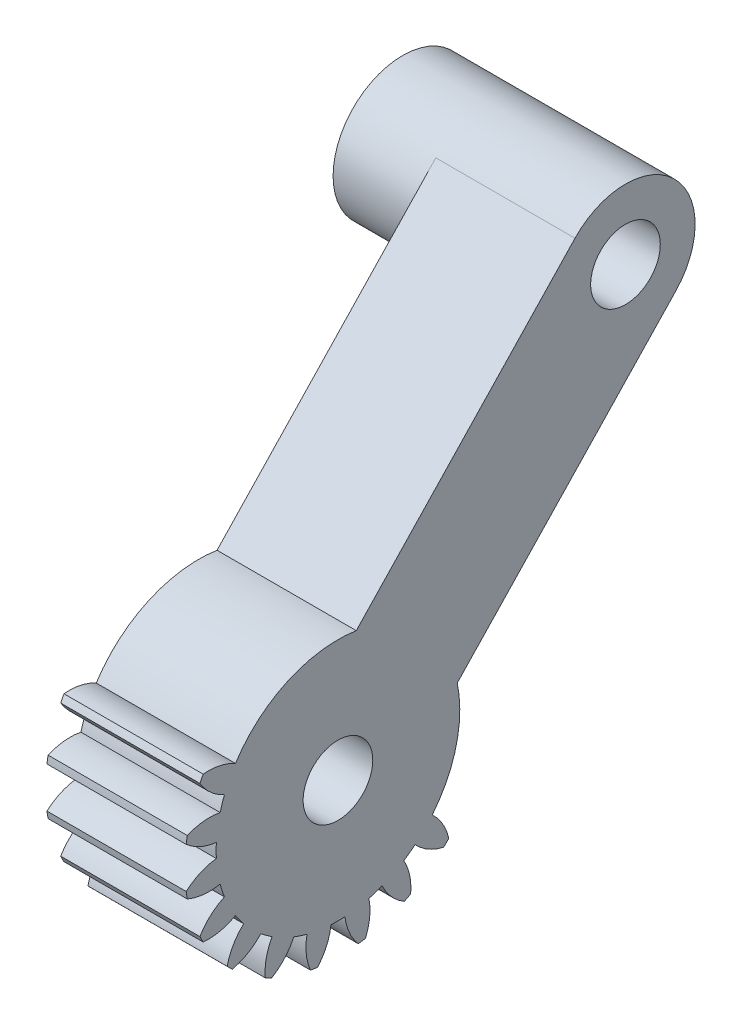
from build123d import *
from build123d.topology import SkipClean

# Parameters (mm, degrees)
SKETCH1_R           = 2.5
BOSS_EXTRUDE1_DEPTH = 10
SKETCH2_R           = 2.5
BOSS_EXTRUDE2_DEPTH = 10
SKETCH3_R           = 5
SKETCH3_R_2         = 2.5
BOSS_EXTRUDE3_DEPTH = 6
SKETCH4_R           = 2.5
CUT_EXTRUDE1_DEPTH  = 41.209967862
CUT_EXTRUDE2_DEPTH  = 41.209967862


with BuildPart() as part:
    # Sketch1 → Boss-Extrude1 (new body)
    with BuildSketch(Plane(origin=(4.043870029, 0, 0), x_dir=(0, 0, -1), z_dir=(1, 0, 0))):
        with BuildLine():
            ThreePointArc((-10.029541992, 0.342879069), (-9.019080639, -0.304016541), (-7.862233613, -0.622153359))
            ThreePointArc((-7.862233613, -0.622153359), (-7.876528296, -1.122077366), (-7.862233613, -1.622001374))
            ThreePointArc((-7.862233613, -1.622001374), (-9.019080639, -1.940138191), (-10.029541992, -2.587033801))
            ThreePointArc((-10.029541992, -2.587033801), (-9.992100042, -2.842856482), (-9.948655897, -3.097728508))
            ThreePointArc((-9.948655897, -3.097728508), (-8.787748306, -3.400713063), (-7.58921172, -3.345793765))
            ThreePointArc((-7.58921172, -3.345793765), (-7.448321757, -3.82566705), (-7.280241692, -4.296705735))
            ThreePointArc((-7.280241692, -4.296705735), (-8.282158911, -4.956757219), (-9.043263028, -5.884241235))
            ThreePointArc((-9.043263028, -5.884241235), (-8.928600062, -6.115972863), (-8.808522437, -6.344945585))
            ThreePointArc((-8.808522437, -6.344945585), (-7.610806331, -6.274360846), (-6.487901298, -5.851761317))
            ThreePointArc((-6.487901298, -5.851761317), (-6.20561798, -6.264610538), (-5.90020538, -6.660655353))
            ThreePointArc((-5.90020538, -6.660655353), (-6.649118154, -7.598011066), (-7.086362862, -8.715294889))
            ThreePointArc((-7.086362862, -8.715294889), (-6.905702889, -8.900251959), (-6.720745819, -9.080911932))
            ThreePointArc((-6.720745819, -9.080911932), (-5.603461996, -8.643667224), (-4.666106283, -7.89475445))
            ThreePointArc((-4.666106283, -7.89475445), (-4.270061468, -8.20016705), (-3.857212247, -8.482450368))
            ThreePointArc((-3.857212247, -8.482450368), (-4.279811776, -9.605355401), (-4.350396515, -10.803071507))
            ThreePointArc((-4.350396515, -10.803071507), (-4.121423793, -10.923149132), (-3.889692165, -11.037812099))
            ThreePointArc((-3.889692165, -11.037812099), (-2.962208149, -10.276707981), (-2.302156665, -9.274790762))
            ThreePointArc((-2.302156665, -9.274790762), (-1.83111798, -9.442870827), (-1.351244695, -9.583760791))
            ThreePointArc((-1.351244695, -9.583760791), (-1.406163992, -10.782297376), (-1.103179437, -11.943204968))
            ThreePointArc((-1.103179437, -11.943204968), (-0.848307411, -11.986649113), (-0.592484731, -12.024091063))
            ThreePointArc((-0.592484731, -12.024091063), (0.054410879, -11.01362971), (0.372547697, -9.856782684))
            ThreePointArc((0.372547697, -9.856782684), (0.872471704, -9.871077366), (1.372395712, -9.856782684))
            ThreePointArc((1.372395712, -9.856782684), (1.690532529, -11.01362971), (2.337428139, -12.024091063))
            ThreePointArc((2.337428139, -12.024091063), (2.59325082, -11.986649113), (2.848122846, -11.943204968))
            ThreePointArc((2.848122846, -11.943204968), (3.151107401, -10.782297376), (3.096188103, -9.583760791))
            ThreePointArc((3.096188103, -9.583760791), (3.576061388, -9.442870827), (4.047100073, -9.274790762))
            ThreePointArc((4.047100073, -9.274790762), (4.707151558, -10.276707981), (5.634635573, -11.037812099))
            ThreePointArc((5.634635573, -11.037812099), (5.866367201, -10.923149132), (6.095339923, -10.803071507))
            ThreePointArc((6.095339923, -10.803071507), (6.024755184, -9.605355401), (5.602155655, -8.482450368))
            ThreePointArc((5.602155655, -8.482450368), (6.015004877, -8.20016705), (6.411049691, -7.89475445))
            ThreePointArc((6.411049691, -7.89475445), (7.348405404, -8.643667224), (8.465689227, -9.080911932))
            ThreePointArc((8.465689227, -9.080911932), (8.650646297, -8.900251959), (8.83130627, -8.715294889))
            ThreePointArc((8.83130627, -8.715294889), (8.394061563, -7.598011066), (7.645148788, -6.660655353))
            ThreePointArc((7.645148788, -6.660655353), (7.950561388, -6.264610538), (8.232844706, -5.851761317))
            ThreePointArc((8.232844706, -5.851761317), (9.355749739, -6.274360846), (10.553465846, -6.344945585))
            ThreePointArc((10.553465846, -6.344945585), (10.67354347, -6.115972863), (10.788206437, -5.884241235))
            ThreePointArc((10.788206437, -5.884241235), (10.02710232, -4.956757219), (9.0251851, -4.296705735))
            ThreePointArc((9.0251851, -4.296705735), (9.193265165, -3.82566705), (9.334155129, -3.345793765))
            ThreePointArc((9.334155129, -3.345793765), (10.532691714, -3.400713063), (11.693599306, -3.097728508))
            ThreePointArc((11.693599306, -3.097728508), (11.737043451, -2.842856482), (11.774485401, -2.587033801))
            ThreePointArc((11.774485401, -2.587033801), (10.764024048, -1.940138191), (9.607177022, -1.622001374))
            ThreePointArc((9.607177022, -1.622001374), (9.621471704, -1.122077366), (9.607177022, -0.622153359))
            ThreePointArc((9.607177022, -0.622153359), (10.764024048, -0.304016541), (11.774485401, 0.342879069))
            ThreePointArc((11.774485401, 0.342879069), (11.737043451, 0.598701749), (11.693599306, 0.853573775))
            ThreePointArc((11.693599306, 0.853573775), (10.532691714, 1.156558331), (9.334155129, 1.101639033))
            ThreePointArc((9.334155129, 1.101639033), (9.193265165, 1.581512318), (9.0251851, 2.052551003))
            ThreePointArc((9.0251851, 2.052551003), (10.02710232, 2.712602487), (10.788206437, 3.640086503))
            ThreePointArc((10.788206437, 3.640086503), (10.67354347, 3.871818131), (10.553465846, 4.100790853))
            ThreePointArc((10.553465846, 4.100790853), (9.355749739, 4.030206114), (8.232844706, 3.607606585))
            ThreePointArc((8.232844706, 3.607606585), (7.950561388, 4.020455806), (7.645148788, 4.416500621))
            ThreePointArc((7.645148788, 4.416500621), (8.394061563, 5.353856334), (8.83130627, 6.471140157))
            ThreePointArc((8.83130627, 6.471140157), (8.650646297, 6.656097227), (8.465689227, 6.8367572))
            ThreePointArc((8.465689227, 6.8367572), (7.348405404, 6.399512492), (6.411049691, 5.650599718))
            ThreePointArc((6.411049691, 5.650599718), (6.015004877, 5.956012318), (5.602155655, 6.238295636))
            ThreePointArc((5.602155655, 6.238295636), (6.024755184, 7.361200669), (6.095339923, 8.558916775))
            ThreePointArc((6.095339923, 8.558916775), (5.866367201, 8.6789944), (5.634635573, 8.793657366))
            ThreePointArc((5.634635573, 8.793657366), (4.707151558, 8.032553249), (4.047100073, 7.03063603))
            ThreePointArc((4.047100073, 7.03063603), (3.576061388, 7.198716095), (3.096188103, 7.339606058))
            ThreePointArc((3.096188103, 7.339606058), (3.151107401, 8.538142644), (2.848122846, 9.699050235))
            ThreePointArc((2.848122846, 9.699050235), (2.59325082, 9.74249438), (2.337428139, 9.779936331))
            ThreePointArc((2.337428139, 9.779936331), (1.690532529, 8.769474978), (1.372395712, 7.612627952))
            ThreePointArc((1.372395712, 7.612627952), (0.872471704, 7.626922634), (0.372547697, 7.612627952))
            ThreePointArc((0.372547697, 7.612627952), (0.054410879, 8.769474978), (-0.592484731, 9.779936331))
            ThreePointArc((-0.592484731, 9.779936331), (-0.848307411, 9.74249438), (-1.103179437, 9.699050235))
            ThreePointArc((-1.103179437, 9.699050235), (-1.406163992, 8.538142644), (-1.351244695, 7.339606058))
            ThreePointArc((-1.351244695, 7.339606058), (-1.83111798, 7.198716095), (-2.302156665, 7.03063603))
            ThreePointArc((-2.302156665, 7.03063603), (-2.962208149, 8.032553249), (-3.889692165, 8.793657366))
            ThreePointArc((-3.889692165, 8.793657366), (-4.121423793, 8.6789944), (-4.350396515, 8.558916775))
            ThreePointArc((-4.350396515, 8.558916775), (-4.279811776, 7.361200669), (-3.857212247, 6.238295636))
            ThreePointArc((-3.857212247, 6.238295636), (-4.270061468, 5.956012318), (-4.666106283, 5.650599718))
            ThreePointArc((-4.666106283, 5.650599718), (-5.603461996, 6.399512492), (-6.720745819, 6.8367572))
            ThreePointArc((-6.720745819, 6.8367572), (-6.905702889, 6.656097227), (-7.086362862, 6.471140157))
            ThreePointArc((-7.086362862, 6.471140157), (-6.649118154, 5.353856334), (-5.90020538, 4.416500621))
            ThreePointArc((-5.90020538, 4.416500621), (-6.20561798, 4.020455806), (-6.487901298, 3.607606585))
            ThreePointArc((-6.487901298, 3.607606585), (-7.610806331, 4.030206114), (-8.808522437, 4.100790853))
            ThreePointArc((-8.808522437, 4.100790853), (-8.928600062, 3.871818131), (-9.043263028, 3.640086503))
            ThreePointArc((-9.043263028, 3.640086503), (-8.282158911, 2.712602487), (-7.280241692, 2.052551003))
            ThreePointArc((-7.280241692, 2.052551003), (-7.448321757, 1.581512318), (-7.58921172, 1.101639033))
            ThreePointArc((-7.58921172, 1.101639033), (-8.787748306, 1.156558331), (-9.948655897, 0.853573775))
            ThreePointArc((-9.948655897, 0.853573775), (-9.992100042, 0.598701749), (-10.029541992, 0.342879069))
        make_face()
        with Locations((0.872471704, -1.122077366)):
            Circle(SKETCH1_R, mode=Mode.SUBTRACT)
    extrude(amount=-BOSS_EXTRUDE1_DEPTH)

    # Sketch2 → Boss-Extrude2 (add)
    with BuildSketch(Plane(origin=(4.043870029, 0, 0), x_dir=(0, 0, -1), z_dir=(1, 0, 0))):
        with BuildLine():
            Line((17.89623712, 24.080926643), (-2.754400151, 2.319695512))
            ThreePointArc((-2.754400151, 2.319695512), (-2.569301174, -4.748949221), (4.499343559, -4.563850245))
            Line((4.499343559, -4.563850245), (25.14998083, 17.197380886))
            ThreePointArc((25.14998083, 17.197380886), (26.523055214, 20.662340065), (25.117904395, 24.114415753))
            ThreePointArc((25.117904395, 24.114415753), (24.964881853, 24.266025619), (24.805471182, 24.410903801))
            ThreePointArc((24.805471182, 24.410903801), (21.284586532, 25.633461228), (17.89623712, 24.080926643))
        make_face()
        with Locations((21.523108975, 20.639153764)):
            Circle(SKETCH2_R, mode=Mode.SUBTRACT)
    extrude(amount=-BOSS_EXTRUDE2_DEPTH)

    # Sketch3 → Boss-Extrude3 (add)
    with SkipClean():  # the faces are left unmerged after this step: merging them gives an invalid solid
        with BuildSketch(Plane.ZY.offset(5.956129971)):
            with Locations((-21.523108975, 20.639153764)):
                Circle(SKETCH3_R)
            with Locations((-21.523108975, 20.639153764)):
                Circle(SKETCH3_R_2, mode=Mode.SUBTRACT)
        extrude(amount=BOSS_EXTRUDE3_DEPTH)

    # Sketch4 → Cut-Extrude1 (cut, through all)
    with SkipClean():  # the faces are left unmerged after this step: merging them gives an invalid solid
        with BuildSketch(Plane(origin=(4.043870029, 0, 0), x_dir=(0, 0, -1), z_dir=(1, 0, 0))):
            with Locations((0.872471704, -1.122077366)):
                Circle(SKETCH4_R)
        extrude(amount=-CUT_EXTRUDE1_DEPTH, mode=Mode.SUBTRACT)

    # Sketch6 → Cut-Extrude2 (cut, through all)
    with SkipClean():  # the faces are left unmerged after this step: merging them gives an invalid solid
        with BuildSketch(Plane(origin=(4.043870029, 0, 0), x_dir=(0, 0, -1), z_dir=(1, 0, 0))):
            with BuildLine():
                Line((4.579688985, 10.048212881), (2.187631015, 7.527509733))
                ThreePointArc((2.187631015, 7.527509733), (-2.46576826, 6.965020688), (-6.16100093, 4.08131227))
                Line((-6.16100093, 4.08131227), (-8.58915512, 5.877669916))
                ThreePointArc((-8.58915512, 5.877669916), (-2.68093011, 10.098091069), (4.579688985, 10.048212881))
            make_face()
            with BuildLine():
                Line((11.833432695, 3.164667124), (9.441374725, 0.643963976))
                ThreePointArc((9.441374725, 0.643963976), (9.424184018, -2.969566881), (7.948146758, -6.267932352))
                Line((7.948146758, -6.267932352), (10.39087042, -8.044427405))
                ThreePointArc((10.39087042, -8.044427405), (12.54560297, -2.624359175), (11.833432695, 3.164667124))
            make_face()
        extrude(amount=-CUT_EXTRUDE2_DEPTH, mode=Mode.SUBTRACT)


solid = part.part
